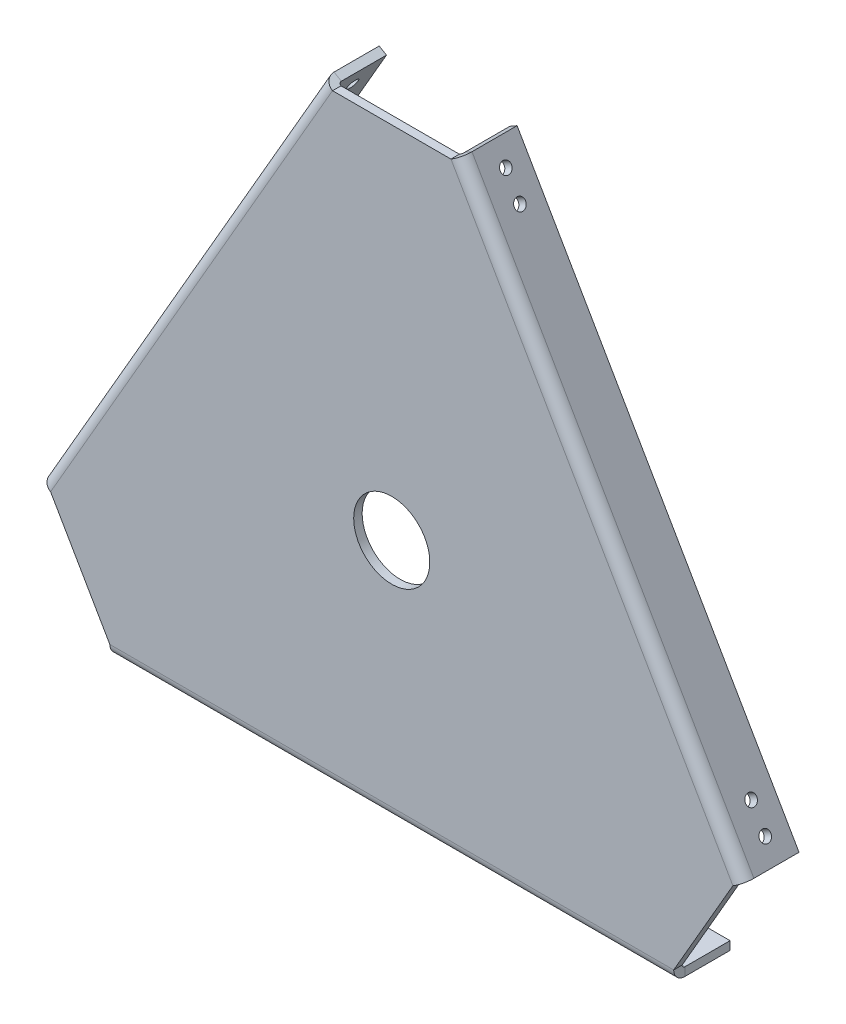
from build123d import *

# Parameters (mm, degrees)
SM_BASE_FLANGE_3_DEPTH        = 3
SM_EDGE_FLANGE_6_DEPTH        = 200
SM_EDGE_FLANGE_6_BEND_DEPTH   = 200
SM_EDGE_FLANGE_6_BEND_2_DEPTH = 200
CUT_EXTRUDE_4_REACH           = 325.007
SKETCH_47_R                   = 2
CUT_EXTRUDE_6_REACH           = 239.77
SKETCH_50_R                   = 2
CUT_EXTRUDE_7_REACH           = 313.862
SKETCH_51_R                   = 2
CUT_EXTRUDE_8_REACH           = 310.931
SKETCH_52_R                   = 13.5


# Sheet-metal steps are written as plain solids
with BuildPart() as part:
    # Эскиз10 → Базовая кромка3 (new body)
    with BuildSketch(Plane.XY):
        Polygon((0, 0), (-21, 36.373066959), (79, 209.578147716), (121, 209.578147716), (221, 36.373066959), (200, 0), align=None)
    extrude(amount=-SM_BASE_FLANGE_3_DEPTH)

    # Ребро-кромка6 section (across the edge) → Ребро-кромка6 (add)
    with BuildSketch(Plane(origin=(-21.866025404, 36.873066959, -3), x_dir=(0.8660254037844437, -0.4999999999999915, -3.4914813388431334e-15), z_dir=(0.4999999999999915, 0.8660254037844437, 0))):
        with BuildLine():
            Line((-3, 1), (-3, 17))
            Line((-3, 17), (0, 17))
            Line((0, 17), (0, 1))
            ThreePointArc((0, 1), (0.292893219, 0.292893219), (1, 0))
            Line((1, 0), (1, -3))
            ThreePointArc((1, -3), (-1.828427125, -1.828427125), (-3, 1))
        make_face()
    extrude(amount=SM_EDGE_FLANGE_6_DEPTH)

    # Ребро-кромка6 section 2 (across the edge) → Ребро-кромка6 bend (add)
    with BuildSketch(Plane(origin=(121.866025404, 210.078147716, -3), x_dir=(-0.8660254037844362, -0.5000000000000044, -3.491481338843134e-15), z_dir=(0.5000000000000044, -0.8660254037844362, 0))):
        with BuildLine():
            Line((-3, 1), (-3, 17))
            Line((-3, 17), (0, 17))
            Line((0, 17), (0, 1))
            ThreePointArc((0, 1), (0.292893219, 0.292893219), (1, 0))
            Line((1, 0), (1, -3))
            ThreePointArc((1, -3), (-1.828427125, -1.828427125), (-3, 1))
        make_face()
    extrude(amount=SM_EDGE_FLANGE_6_BEND_DEPTH)

    # Ребро-кромка6 section 3 (across the edge) → Ребро-кромка6 bend 2 (add)
    with BuildSketch(Plane(origin=(200, -1, -3), x_dir=(0, 1, 0), z_dir=(-1, 0, 0))):
        with BuildLine():
            Line((-3, 1), (-3, 17))
            Line((-3, 17), (0, 17))
            Line((0, 17), (0, 1))
            ThreePointArc((0, 1), (0.292893219, 0.292893219), (1, 0))
            Line((1, 0), (1, -3))
            ThreePointArc((1, -3), (-1.828427125, -1.828427125), (-3, 1))
        make_face()
    extrude(amount=SM_EDGE_FLANGE_6_BEND_2_DEPTH)

    # Эскиз47 → Вырез-Вытянуть4 (cut, up to next)
    with BuildSketch(Plane(origin=(-34.964101615, 20.186533479, 0), x_dir=(0, 0, 1), z_dir=(-0.866025403784443, 0.4999999999999925, 3.788649256556814e-15)), mode=Mode.PRIVATE) as cut_extrude_4_sk1:
        with Locations(Location((-12, 29, 0), (0, 0, 270))):
            Circle(SKETCH_47_R)
    cut_extrude_4_tool1 = extrude(cut_extrude_4_sk1.sketch, amount=-CUT_EXTRUDE_4_REACH, mode=Mode.PRIVATE) & part.part
    # Эскиз47 → Вырез-Вытянуть4 (cut, up to next)
    with BuildSketch(Plane(origin=(-34.964101615, 20.186533479, 0), x_dir=(0, 0, 1), z_dir=(-0.866025403784443, 0.4999999999999925, 3.788649256556814e-15)), mode=Mode.PRIVATE) as cut_extrude_4_sk2:
        with Locations(Location((-12, 39, 0), (0, 0, 270))):
            Circle(SKETCH_47_R)
    cut_extrude_4_tool2 = extrude(cut_extrude_4_sk2.sketch, amount=-CUT_EXTRUDE_4_REACH, mode=Mode.PRIVATE) & part.part
    # Эскиз47 → Вырез-Вытянуть4 (cut, up to next)
    with BuildSketch(Plane(origin=(-34.964101615, 20.186533479, 0), x_dir=(0, 0, 1), z_dir=(-0.866025403784443, 0.4999999999999925, 3.788649256556814e-15)), mode=Mode.PRIVATE) as cut_extrude_4_sk3:
        with Locations(Location((-12, 203, 0), (0, 0, 270))):
            Circle(SKETCH_47_R)
    cut_extrude_4_tool3 = extrude(cut_extrude_4_sk3.sketch, amount=-CUT_EXTRUDE_4_REACH, mode=Mode.PRIVATE) & part.part
    # Эскиз47 → Вырез-Вытянуть4 (cut, up to next)
    with BuildSketch(Plane(origin=(-34.964101615, 20.186533479, 0), x_dir=(0, 0, 1), z_dir=(-0.866025403784443, 0.4999999999999925, 3.788649256556814e-15)), mode=Mode.PRIVATE) as cut_extrude_4_sk4:
        with Locations(Location((-12, 213, 0), (0, 0, 270))):
            Circle(SKETCH_47_R)
    cut_extrude_4_tool4 = extrude(cut_extrude_4_sk4.sketch, amount=-CUT_EXTRUDE_4_REACH, mode=Mode.PRIVATE) & part.part
    add(cut_extrude_4_tool1.solids().sort_by_distance((-20.464102, 45.30127, -12))[0], mode=Mode.SUBTRACT)
    add(cut_extrude_4_tool2.solids().sort_by_distance((-15.464102, 53.961524, -12))[0], mode=Mode.SUBTRACT)
    add(cut_extrude_4_tool3.solids().sort_by_distance((66.535898, 195.98969, -12))[0], mode=Mode.SUBTRACT)
    add(cut_extrude_4_tool4.solids().sort_by_distance((71.535898, 204.649944, -12))[0], mode=Mode.SUBTRACT)

    # Эскиз50 → Вырез-Вытянуть6 (cut, up to next)
    with BuildSketch(Plane(origin=(184.964101615, 106.789073858, 0), x_dir=(0, 0, -1), z_dir=(0.866025403784436, 0.5000000000000047, 3.0623287353932815e-15)), mode=Mode.PRIVATE) as cut_extrude_6_sk1:
        with Locations(Location((12, -71, 0), (0, 0, 90))):
            Circle(SKETCH_50_R)
    cut_extrude_6_tool1 = extrude(cut_extrude_6_sk1.sketch, amount=-CUT_EXTRUDE_6_REACH, mode=Mode.PRIVATE) & part.part
    # Эскиз50 → Вырез-Вытянуть6 (cut, up to next)
    with BuildSketch(Plane(origin=(184.964101615, 106.789073858, 0), x_dir=(0, 0, -1), z_dir=(0.866025403784436, 0.5000000000000047, 3.0623287353932815e-15)), mode=Mode.PRIVATE) as cut_extrude_6_sk2:
        with Locations(Location((12, -61, 0), (0, 0, 90))):
            Circle(SKETCH_50_R)
    cut_extrude_6_tool2 = extrude(cut_extrude_6_sk2.sketch, amount=-CUT_EXTRUDE_6_REACH, mode=Mode.PRIVATE) & part.part
    # Эскиз50 → Вырез-Вытянуть6 (cut, up to next)
    with BuildSketch(Plane(origin=(184.964101615, 106.789073858, 0), x_dir=(0, 0, -1), z_dir=(0.866025403784436, 0.5000000000000047, 3.0623287353932815e-15)), mode=Mode.PRIVATE) as cut_extrude_6_sk3:
        with Locations(Location((12, 103, 0), (0, 0, 90))):
            Circle(SKETCH_50_R)
    cut_extrude_6_tool3 = extrude(cut_extrude_6_sk3.sketch, amount=-CUT_EXTRUDE_6_REACH, mode=Mode.PRIVATE) & part.part
    # Эскиз50 → Вырез-Вытянуть6 (cut, up to next)
    with BuildSketch(Plane(origin=(184.964101615, 106.789073858, 0), x_dir=(0, 0, -1), z_dir=(0.866025403784436, 0.5000000000000047, 3.0623287353932815e-15)), mode=Mode.PRIVATE) as cut_extrude_6_sk4:
        with Locations(Location((12, 113, 0), (0, 0, 90))):
            Circle(SKETCH_50_R)
    cut_extrude_6_tool4 = extrude(cut_extrude_6_sk4.sketch, amount=-CUT_EXTRUDE_6_REACH, mode=Mode.PRIVATE) & part.part
    add(cut_extrude_6_tool1.solids().sort_by_distance((220.464102, 45.30127, -12))[0], mode=Mode.SUBTRACT)
    add(cut_extrude_6_tool2.solids().sort_by_distance((215.464102, 53.961524, -12))[0], mode=Mode.SUBTRACT)
    add(cut_extrude_6_tool3.solids().sort_by_distance((133.464102, 195.98969, -12))[0], mode=Mode.SUBTRACT)
    add(cut_extrude_6_tool4.solids().sort_by_distance((128.464102, 204.649944, -12))[0], mode=Mode.SUBTRACT)

    # Эскиз51 → Вырез-Вытянуть7 (cut, up to next)
    with BuildSketch(Plane.XZ.offset(4), mode=Mode.PRIVATE) as cut_extrude_7_sk1:
        with Locations(Location((192, -12, 0), (0, 0, 270))):
            Circle(SKETCH_51_R)
    cut_extrude_7_tool1 = extrude(cut_extrude_7_sk1.sketch, amount=-CUT_EXTRUDE_7_REACH, mode=Mode.PRIVATE) & part.part
    # Эскиз51 → Вырез-Вытянуть7 (cut, up to next)
    with BuildSketch(Plane.XZ.offset(4), mode=Mode.PRIVATE) as cut_extrude_7_sk2:
        with Locations(Location((182, -12, 0), (0, 0, 270))):
            Circle(SKETCH_51_R)
    cut_extrude_7_tool2 = extrude(cut_extrude_7_sk2.sketch, amount=-CUT_EXTRUDE_7_REACH, mode=Mode.PRIVATE) & part.part
    # Эскиз51 → Вырез-Вытянуть7 (cut, up to next)
    with BuildSketch(Plane.XZ.offset(4), mode=Mode.PRIVATE) as cut_extrude_7_sk3:
        with Locations(Location((18, -12, 0), (0, 0, 270))):
            Circle(SKETCH_51_R)
    cut_extrude_7_tool3 = extrude(cut_extrude_7_sk3.sketch, amount=-CUT_EXTRUDE_7_REACH, mode=Mode.PRIVATE) & part.part
    # Эскиз51 → Вырез-Вытянуть7 (cut, up to next)
    with BuildSketch(Plane.XZ.offset(4), mode=Mode.PRIVATE) as cut_extrude_7_sk4:
        with Locations(Location((8, -12, 0), (0, 0, 270))):
            Circle(SKETCH_51_R)
    cut_extrude_7_tool4 = extrude(cut_extrude_7_sk4.sketch, amount=-CUT_EXTRUDE_7_REACH, mode=Mode.PRIVATE) & part.part
    add(cut_extrude_7_tool1.solids().sort_by_distance((192, -4, -12))[0], mode=Mode.SUBTRACT)
    add(cut_extrude_7_tool2.solids().sort_by_distance((182, -4, -12))[0], mode=Mode.SUBTRACT)
    add(cut_extrude_7_tool3.solids().sort_by_distance((18, -4, -12))[0], mode=Mode.SUBTRACT)
    add(cut_extrude_7_tool4.solids().sort_by_distance((8, -4, -12))[0], mode=Mode.SUBTRACT)

    # Эскиз52 → Вырез-Вытянуть8 (cut, up to next)
    with BuildSketch(Plane(origin=(0, 0, -3), x_dir=(-1, 0, 0), z_dir=(0, 0, -1)), mode=Mode.PRIVATE) as cut_extrude_8_sk1:
        with Locations((-100, 81.983738225)):
            Circle(SKETCH_52_R)
    cut_extrude_8_tool1 = extrude(cut_extrude_8_sk1.sketch, amount=-CUT_EXTRUDE_8_REACH, mode=Mode.PRIVATE) & part.part
    add(cut_extrude_8_tool1.solids().sort_by_distance((100, 81.983738, -3))[0], mode=Mode.SUBTRACT)


solid = part.part
